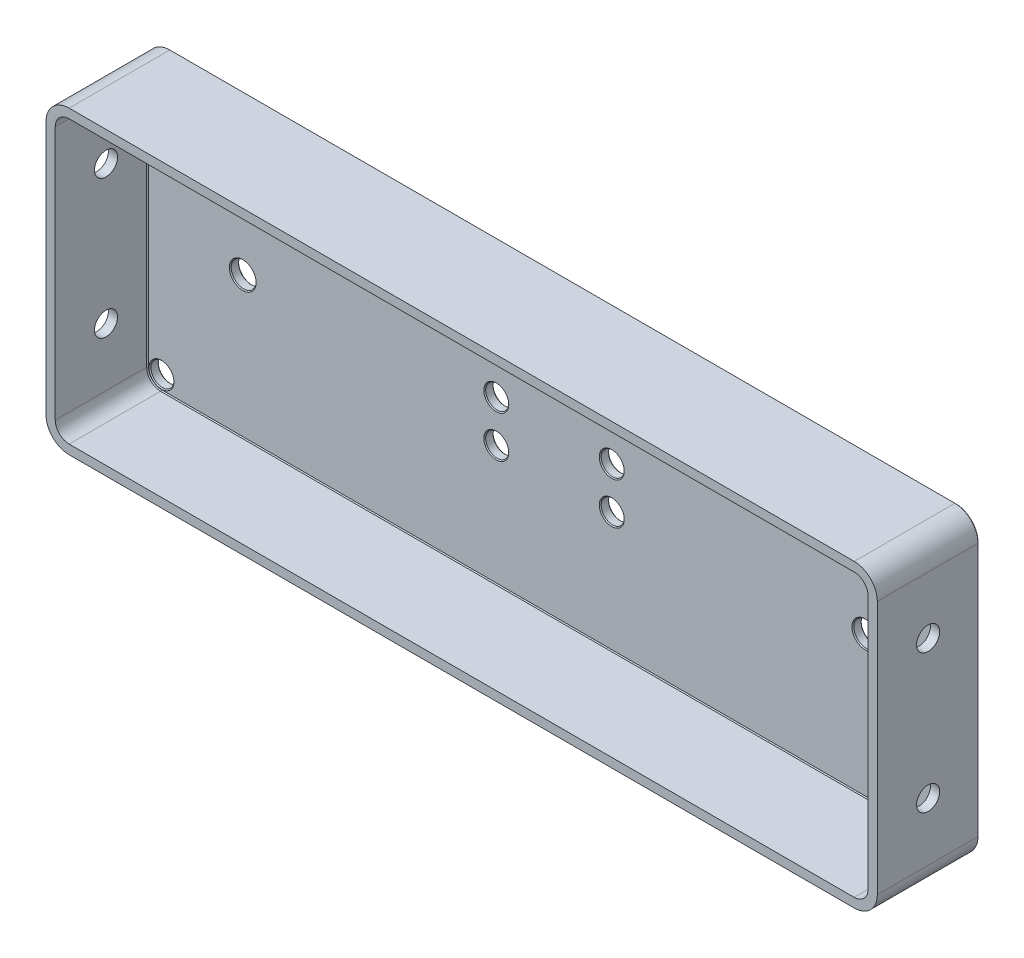
from build123d import *

# Parameters (mm, degrees)
SKETCH3_R           = 3.175
SKETCH3_R_2         = 3.429
BOSS_EXTRUDE1_DEPTH = 27.94
CUT_EXTRUDE1_DEPTH  = 25.4
CHAMFER1_SIZE       = 0.254
CHAMFER2_SIZE       = 0.254
SKETCH5_R           = 3.175
CUT_EXTRUDE2_DEPTH  = 234.970573417


with BuildPart() as part:
    # Sketch3 → Boss-Extrude1 (new body)
    with BuildSketch(Plane.XY):
        with BuildLine():
            Line((107.95, -41.275), (-107.95, -41.275))
            ThreePointArc((-107.95, -41.275), (-112.440128061, -39.415128061), (-114.3, -34.925))
            Line((-114.3, -34.925), (-114.3, 34.925))
            ThreePointArc((-114.3, 34.925), (-112.440128061, 39.415128061), (-107.95, 41.275))
            Line((-107.95, 41.275), (107.95, 41.275))
            ThreePointArc((107.95, 41.275), (112.440128061, 39.415128061), (114.3, 34.925))
            Line((114.3, 34.925), (114.3, -34.925))
            ThreePointArc((114.3, -34.925), (112.440128061, -39.415128061), (107.95, -41.275))
        make_face()
        with Locations((-107.95, 34.925)):
            Circle(SKETCH3_R, mode=Mode.SUBTRACT)
        with Locations((-107.95, -34.925)):
            Circle(SKETCH3_R, mode=Mode.SUBTRACT)
        with Locations((107.95, -34.925)):
            Circle(SKETCH3_R, mode=Mode.SUBTRACT)
        with Locations((107.95, 34.925)):
            Circle(SKETCH3_R, mode=Mode.SUBTRACT)
        with Locations((-85.598, 0)):
            Circle(SKETCH3_R_2, mode=Mode.SUBTRACT)
        with Locations((85.598, 0)):
            Circle(SKETCH3_R_2, mode=Mode.SUBTRACT)
        with Locations((-15.875, 5.732638889)):
            Circle(SKETCH3_R, mode=Mode.SUBTRACT)
        with Locations((15.875, 5.732638889)):
            Circle(SKETCH3_R, mode=Mode.SUBTRACT)
        with Locations((15.875, -5.732638889)):
            Circle(SKETCH3_R, mode=Mode.SUBTRACT)
        with Locations((-15.875, -5.732638889)):
            Circle(SKETCH3_R, mode=Mode.SUBTRACT)
    extrude(amount=BOSS_EXTRUDE1_DEPTH)

    # Sketch4 → Cut-Extrude1 (cut)
    with BuildSketch(Plane.XY.offset(27.94)):
        with BuildLine():
            Line((107.95, 38.735), (-107.95, 38.735))
            ThreePointArc((-107.95, 38.735), (-110.644076836, 37.619076836), (-111.76, 34.925))
            Line((-111.76, 34.925), (-111.76, -34.925))
            ThreePointArc((-111.76, -34.925), (-110.644076836, -37.619076836), (-107.95, -38.735))
            Line((-107.95, -38.735), (107.95, -38.735))
            ThreePointArc((107.95, -38.735), (110.644076836, -37.619076836), (111.76, -34.925))
            Line((111.76, -34.925), (111.76, 34.925))
            ThreePointArc((111.76, 34.925), (110.644076836, 37.619076836), (107.95, 38.735))
        make_face()
    extrude(amount=-CUT_EXTRUDE1_DEPTH, mode=Mode.SUBTRACT)

    # Chamfer1
    chamfer1_edges = [part.edges().sort_by_distance(p)[0] for p in [
        (104.775, 34.925, 0),
        (104.775, -34.925, 0),
        (-111.125, -34.925, 0),
        (-111.125, 34.925, 0),
        (82.169, 0, 0),
        (-89.027, 0, 0),
        (0, 41.275, 0),
        (-112.440128061, 39.415128061, 0),
        (-114.3, 0, 0),
        (-112.440128061, -39.415128061, 0),
        (0, -41.275, 0),
        (112.440128061, -39.415128061, 0),
        (114.3, 0, 0),
        (112.440128061, 39.415128061, 0),
        (-19.05, -5.732638889, 0),
        (12.7, -5.732638889, 0),
        (12.7, 5.732638889, 0),
        (-19.05, 5.732638889, 0),
    ]]
    chamfer(chamfer1_edges, length=CHAMFER1_SIZE)

    # Chamfer2
    chamfer2_edges = [part.edges().sort_by_distance(p)[0] for p in [
        (110.644076836, -37.619076836, 2.54),
        (0, -38.735, 2.54),
        (-110.644076836, -37.619076836, 2.54),
        (-111.76, 0, 2.54),
        (-110.644076836, 37.619076836, 2.54),
        (0, 38.735, 2.54),
        (110.644076836, 37.619076836, 2.54),
        (111.76, 0, 2.54),
        (104.775, 34.925, 2.54),
        (104.775, -34.925, 2.54),
        (-111.125, -34.925, 2.54),
        (-111.125, 34.925, 2.54),
        (82.169, 0, 2.54),
        (-89.027, 0, 2.54),
        (-19.05, -5.732638889, 2.54),
        (12.7, -5.732638889, 2.54),
        (12.7, 5.732638889, 2.54),
        (-19.05, 5.732638889, 2.54),
    ]]
    chamfer(chamfer2_edges, length=CHAMFER2_SIZE)

    # Sketch5 → Cut-Extrude2 (cut, through all)
    with BuildSketch(Plane(origin=(114.3, 0, 0), x_dir=(0, 0, -1), z_dir=(1, 0, 0))):
        with Locations((-13.97, 19.177)):
            Circle(SKETCH5_R)
        with Locations((-13.97, -18.923)):
            Circle(SKETCH5_R)
    extrude(amount=-CUT_EXTRUDE2_DEPTH, mode=Mode.SUBTRACT)


solid = part.part
